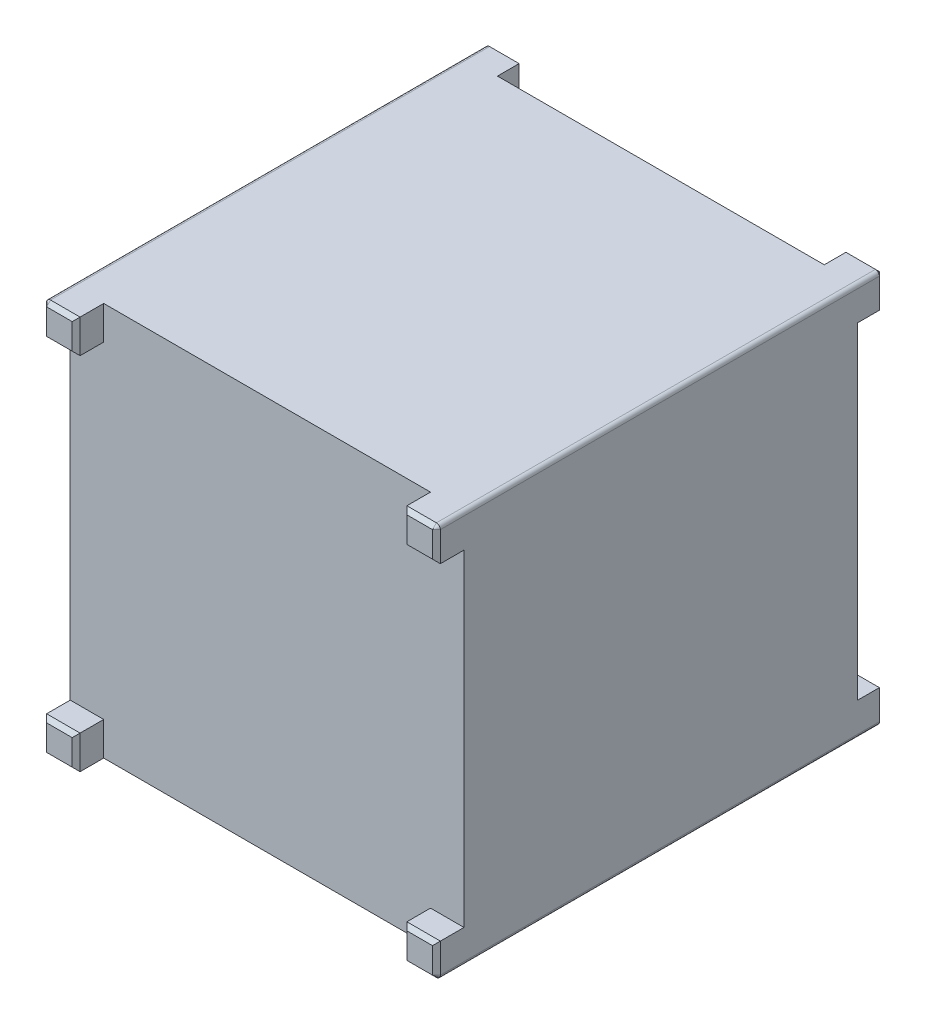
from build123d import *

# Parameters (mm, degrees)
BOSS_EXTRUDE1_DEPTH        = 56.75
BOSS_EXTRUDE1_DEPTH_BACK   = 56.75
SKETCH1_W                  = 8.5
SKETCH1_H                  = 8.5
BOSS_EXTRUDE1_2_DEPTH      = 56.75
BOSS_EXTRUDE1_2_DEPTH_BACK = 56.75
BOSS_EXTRUDE1_3_DEPTH      = 56.75
BOSS_EXTRUDE1_3_DEPTH_BACK = 56.75
BOSS_EXTRUDE1_4_DEPTH      = 56.75
BOSS_EXTRUDE1_4_DEPTH_BACK = 56.75
BOSS_EXTRUDE2_DEPTH        = 49.75
BOSS_EXTRUDE2_DEPTH_BACK   = 50.25
SKETCH2_W                  = 100
SKETCH2_H                  = 100
FILLET1_R                  = 1
CHAMFER2_SIZE              = 1


with BuildPart() as part:
    # Sketch1 → Boss-Extrude1 (new, two sides: drawn at the far end of the back side and taken through both)
    with BuildSketch(Plane.XY.offset(-BOSS_EXTRUDE1_DEPTH_BACK)):
        with Locations((-45.75, 45.75)):
            Rectangle(SKETCH1_W, SKETCH1_H)
    extrude(amount=BOSS_EXTRUDE1_DEPTH + BOSS_EXTRUDE1_DEPTH_BACK)



with BuildPart() as body_2:
    # Sketch1 → Boss-Extrude1 2 (new, two sides: drawn at the far end of the back side and taken through both)
    with BuildSketch(Plane.XY.offset(-BOSS_EXTRUDE1_2_DEPTH_BACK)):
        with Locations((45.75, 45.75)):
            Rectangle(SKETCH1_W, SKETCH1_H)
    extrude(amount=BOSS_EXTRUDE1_2_DEPTH + BOSS_EXTRUDE1_2_DEPTH_BACK)


with BuildPart() as body_3:
    # Sketch1 → Boss-Extrude1 3 (new, two sides: drawn at the far end of the back side and taken through both)
    with BuildSketch(Plane.XY.offset(-BOSS_EXTRUDE1_3_DEPTH_BACK)):
        with Locations((45.75, -45.75)):
            Rectangle(SKETCH1_W, SKETCH1_H)
    extrude(amount=BOSS_EXTRUDE1_3_DEPTH + BOSS_EXTRUDE1_3_DEPTH_BACK)


with BuildPart() as body_4:
    # Sketch1 → Boss-Extrude1 4 (new, two sides: drawn at the far end of the back side and taken through both)
    with BuildSketch(Plane.XY.offset(-BOSS_EXTRUDE1_4_DEPTH_BACK)):
        with Locations((-45.75, -45.75)):
            Rectangle(SKETCH1_W, SKETCH1_H)
    extrude(amount=BOSS_EXTRUDE1_4_DEPTH + BOSS_EXTRUDE1_4_DEPTH_BACK)


with BuildPart() as part_1:
    add(part.part)

    add(body_2.part)  # Boss-Extrude2 merges body 2

    add(body_3.part)  # Boss-Extrude2 merges body 3

    add(body_4.part)  # Boss-Extrude2 merges body 4
    # Sketch2 → Boss-Extrude2 (add, two sides: drawn at the far end of the back side and taken through both)
    with BuildSketch(Plane.XY.offset(-BOSS_EXTRUDE2_DEPTH_BACK)):
        Rectangle(SKETCH2_W, SKETCH2_H)
    extrude(amount=BOSS_EXTRUDE2_DEPTH + BOSS_EXTRUDE2_DEPTH_BACK)

    # Fillet1
    fillet1_edges = [part_1.edges().sort_by_distance(p)[0] for p in [
        (50, -50, 0),
        (-50, -50, 0),
        (-50, 50, 0),
        (50, 50, 0),
    ]]
    fillet(fillet1_edges, radius=FILLET1_R)

    # Chamfer2
    chamfer2_edges = [part_1.edges().sort_by_distance(p)[0] for p in [
        (-45.75, -41.5, 56.75),
        (-41.5, -45.75, 56.75),
        (-45.25, -50, 56.75),
        (-49.707106781, -49.707106781, 56.75),
        (-50, -45.25, 56.75),
        (41.5, -45.75, 56.75),
        (45.75, -41.5, 56.75),
        (50, -45.25, 56.75),
        (49.707106781, -49.707106781, 56.75),
        (45.25, -50, 56.75),
        (45.75, 41.5, 56.75),
        (41.5, 45.75, 56.75),
        (45.25, 50, 56.75),
        (49.707106781, 49.707106781, 56.75),
        (50, 45.25, 56.75),
        (-41.5, 45.75, 56.75),
        (-45.75, 41.5, 56.75),
        (-50, 45.25, 56.75),
        (-49.707106781, 49.707106781, 56.75),
        (-45.25, 50, 56.75),
        (41.5, 45.75, -56.75),
        (45.75, 41.5, -56.75),
        (50, 45.25, -56.75),
        (49.707106781, 49.707106781, -56.75),
        (45.25, 50, -56.75),
        (-45.75, 41.5, -56.75),
        (-41.5, 45.75, -56.75),
        (-45.25, 50, -56.75),
        (-49.707106781, 49.707106781, -56.75),
        (-50, 45.25, -56.75),
        (-41.5, -45.75, -56.75),
        (-45.75, -41.5, -56.75),
        (-50, -45.25, -56.75),
        (-49.707106781, -49.707106781, -56.75),
        (-45.25, -50, -56.75),
        (45.75, -41.5, -56.75),
        (41.5, -45.75, -56.75),
        (45.25, -50, -56.75),
        (49.707106781, -49.707106781, -56.75),
        (50, -45.25, -56.75),
    ]]
    chamfer(chamfer2_edges, length=CHAMFER2_SIZE)


solid = part_1.part
